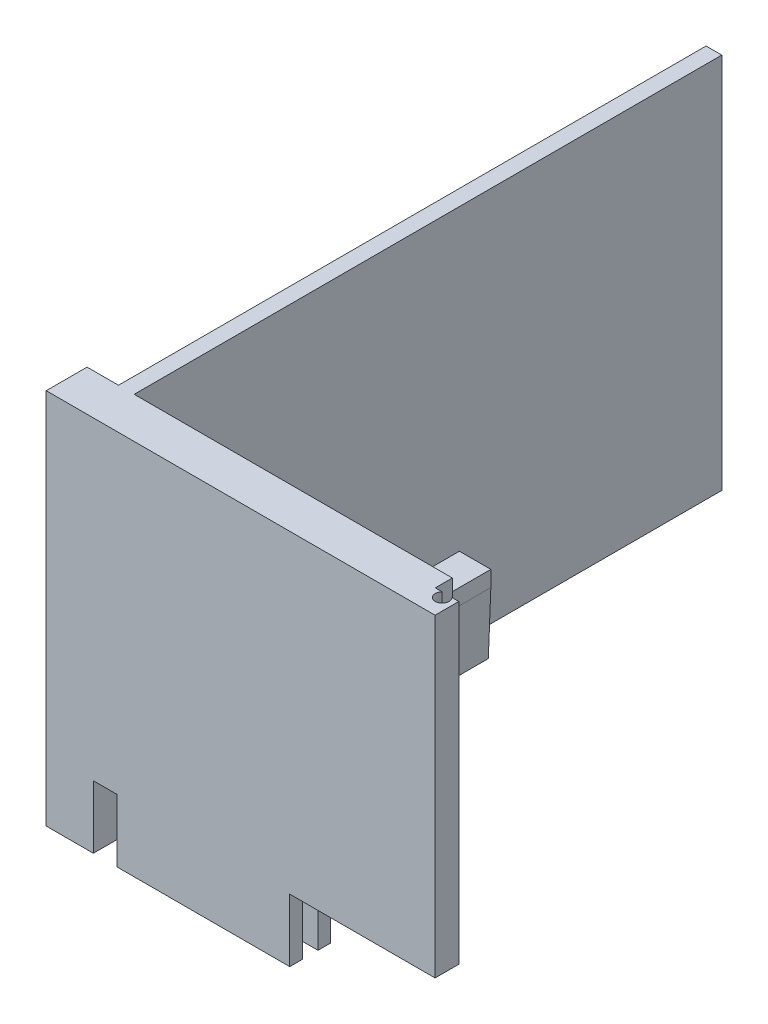
from build123d import *

# Parameters (mm, degrees)
BOSS_EXTRUDE1_DEPTH = 76.2
SKETCH9_W           = 6.35
SKETCH9_H           = 60.325
CUT_EXTRUDE1_DEPTH  = 65.7225
CUT_EXTRUDE2_DEPTH  = 12.7
LEFTCUT_DEPTH       = 76.2


# Read off the part's stored shape, not the designer's step: LeftCut
with BuildPart() as part:
    # Sketch8 → Boss-Extrude1 (new body)
    with BuildSketch(Plane(origin=(0, 0, 0), x_dir=(1, 0, 0), z_dir=(0, 1, 0))):
        Polygon((66.675, 8.255), (-66.675, 8.255), (-66.675, 61.2775), (-60.325, 61.2775), (-60.325, 73.9775), (-66.675, 73.9775), (-66.675, 127), (-69.85, 127), (-69.85, 8.255), (-76.2, 8.255), (-76.2, 0), (76.2, 0), (76.2, 8.255), (69.85, 8.255), (69.85, 127), (66.675, 127), (66.675, 73.9775), (60.325, 73.9775), (60.325, 61.2775), (66.675, 61.2775), align=None)
    extrude(amount=BOSS_EXTRUDE1_DEPTH)

    # Sketch9 → Cut-Extrude1 (cut)
    with BuildSketch(Plane(origin=(0, 0, -73.9775), x_dir=(-1, 0, 0), z_dir=(0, 0, -1))):
        Polygon((-66.675, 12.7), (-66.675, 0), (-64.008, 0), (-63.5, 12.7), align=None)
        Polygon((66.675, 12.7), (63.5, 12.7), (64.008, 0), (66.675, 0), align=None)
        with Locations((-63.5, 46.0375)):
            Rectangle(SKETCH9_W, SKETCH9_H)
        Polygon((-60.325, 0), (-60.325, 12.7), (-60.833, 0), align=None)
        Polygon((-60.198, 15.875), (-60.325, 15.875), (-60.325, 12.7), align=None)
        Polygon((60.833, 0), (60.325, 12.7), (60.325, 0), align=None)
        Polygon((60.325, 12.7), (60.325, 15.875), (60.198, 15.875), align=None)
        with Locations((63.5, 46.0375)):
            Rectangle(SKETCH9_W, SKETCH9_H)
    extrude(amount=-CUT_EXTRUDE1_DEPTH, mode=Mode.SUBTRACT)

    # Sketch10 → Cut-Extrude2 (cut)
    with BuildSketch(Plane.XZ):
        Polygon((26.9875, -5.715), (61.9125, -5.715), (61.9125, -8.255), (66.675, -8.255), (66.675, 0), (61.9125, 0), (61.9125, -2.54), (26.9875, -2.54), (26.9875, 0), (-26.9875, 0), (-26.9875, -2.54), (-61.9125, -2.54), (-61.9125, 0), (-66.675, 0), (-66.675, -8.255), (-61.9125, -8.255), (-61.9125, -5.715), (-26.9875, -5.715), (-26.9875, -8.255), (26.9875, -8.255), align=None)
    extrude(amount=-CUT_EXTRUDE2_DEPTH, mode=Mode.SUBTRACT)

    # LeftCut outline → LeftCut (cut)
    with BuildSketch(Plane(origin=(0, 0, 0), x_dir=(1, 0, 0), z_dir=(0, 1, 0))):
        with BuildLine():
            ThreePointArc((-0.98425, 4.801393432), (0, 2.413), (0.98425, 4.801393432))
            Line((0.98425, 4.801393432), (2.38125, 4.801393432))
            Line((2.38125, 4.801393432), (2.38125, 0))
            Line((2.38125, 0), (76.2, 0))
            Line((76.2, 0), (76.2, 8.255))
            Line((76.2, 8.255), (69.85, 8.255))
            Line((69.85, 8.255), (69.85, 127))
            Line((69.85, 127), (66.675, 127))
            Line((66.675, 127), (66.675, 73.9775))
            Line((66.675, 73.9775), (60.325, 73.9775))
            Line((60.325, 73.9775), (60.325, 61.2775))
            Line((60.325, 61.2775), (66.675, 61.2775))
            Line((66.675, 61.2775), (66.675, 8.255))
            Line((66.675, 8.255), (-2.38125, 8.255))
            Line((-2.38125, 8.255), (-2.38125, 4.801393432))
            Line((-2.38125, 4.801393432), (-0.98425, 4.801393432))
        make_face()
    extrude(amount=LEFTCUT_DEPTH, mode=Mode.SUBTRACT)


solid = part.part
